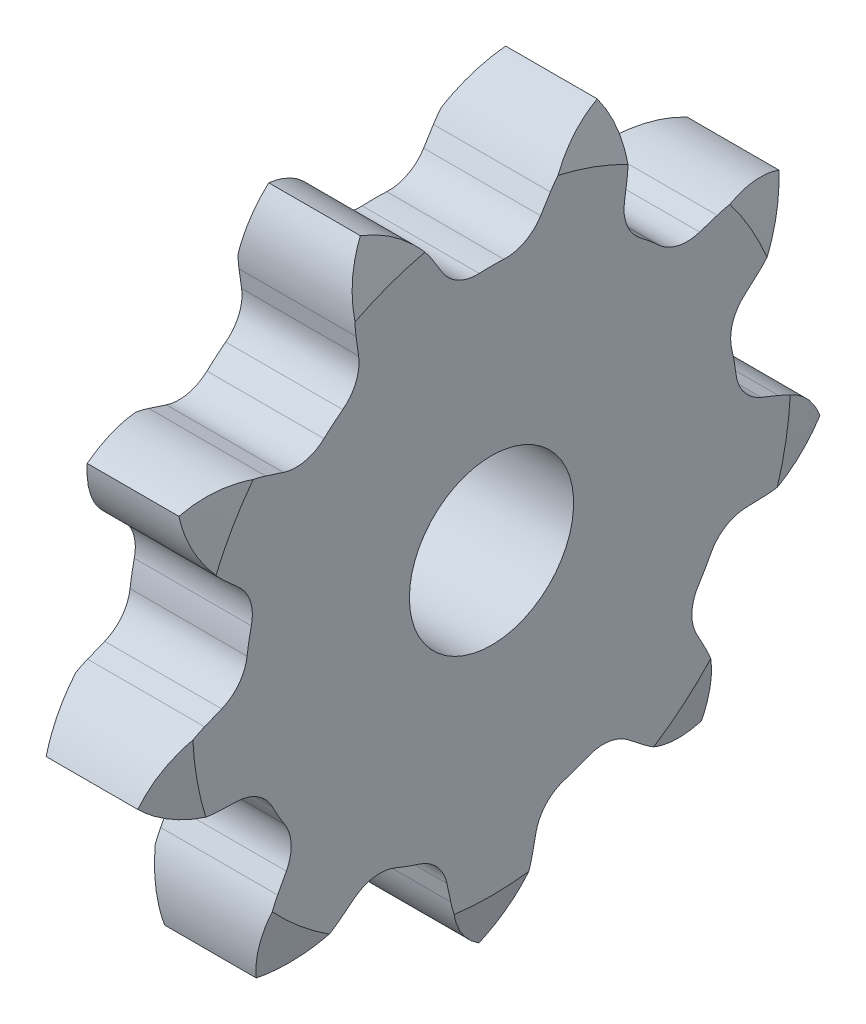
from build123d import *

# Parameters (mm, degrees)
TOOTHCUT_DEPTH  = 158.936618617
TEETHCUTS_COUNT = 9
TEETHCUTS_ANGLE = 320
BORSKE_R        = 25.4
BORE_DEPTH      = 76.2000508


with BuildPart() as part:
    # BasProSke → Base-Revolve (revolve)
    with BuildSketch(Plane(origin=(0, 0, 0), x_dir=(1, 0, 0), z_dir=(0, 1, 0))):
        Polygon((0, 0), (0, 92.496000329), (4.3434, 108.705789807), (31.8516, 108.705789807), (36.195, 92.496000329), (36.195, 0), align=None)
    revolve(axis=Axis((-10, 0, 0), (1, 0, 0)))

    # TooCutSke → ToothCut (cut, through all)
    with BuildSketch(Plane(origin=(0, 0, 0), x_dir=(0, 0, -1), z_dir=(1, 0, 0))):
        with BuildLine():
            Line((-15.194101177, 82.053667195), (-18.222589772, 86.900262065))
            ThreePointArc((-18.222589772, 86.900262065), (-26.141043862, 95.507464096), (-36.638602401, 100.663732776))
            Line((-36.638602401, 100.663732776), (-40.982258221, 112.59782906))
            ThreePointArc((-40.982258221, 112.59782906), (0, 119.824106915), (40.982258221, 112.59782906))
            Line((40.982258221, 112.59782906), (36.638602401, 100.663732776))
            ThreePointArc((36.638602401, 100.663732776), (26.141043862, 95.507464096), (18.222589772, 86.900262065))
            Line((18.222589772, 86.900262065), (15.194101177, 82.053667195))
            ThreePointArc((15.194101177, 82.053667195), (10.302586989, 77.526158745), (3.791861868, 76.099378373))
            ThreePointArc((3.791861868, 76.099378373), (0, 76.193789807), (-3.791861868, 76.099378373))
            ThreePointArc((-3.791861868, 76.099378373), (-10.302586989, 77.526158745), (-15.194101177, 82.053667195))
        make_face()
    toothcut = extrude(amount=TOOTHCUT_DEPTH, mode=Mode.SUBTRACT)

    # TeethCuts: ToothCut ×9 about axis
    teethcuts_axis = Axis((-10, 0, 0), (1, 0, 0))
    for i in range(1, TEETHCUTS_COUNT):
        add(toothcut.rotate(teethcuts_axis, i * TEETHCUTS_ANGLE / (TEETHCUTS_COUNT - 1)), mode=Mode.SUBTRACT)

    # BorSke → Bore (cut, symmetric)
    with BuildSketch(Plane(origin=(0, 0, 0), x_dir=(0, 0, -1), z_dir=(1, 0, 0))):
        Circle(BORSKE_R)
    extrude(amount=BORE_DEPTH, both=True, mode=Mode.SUBTRACT)


solid = part.part
